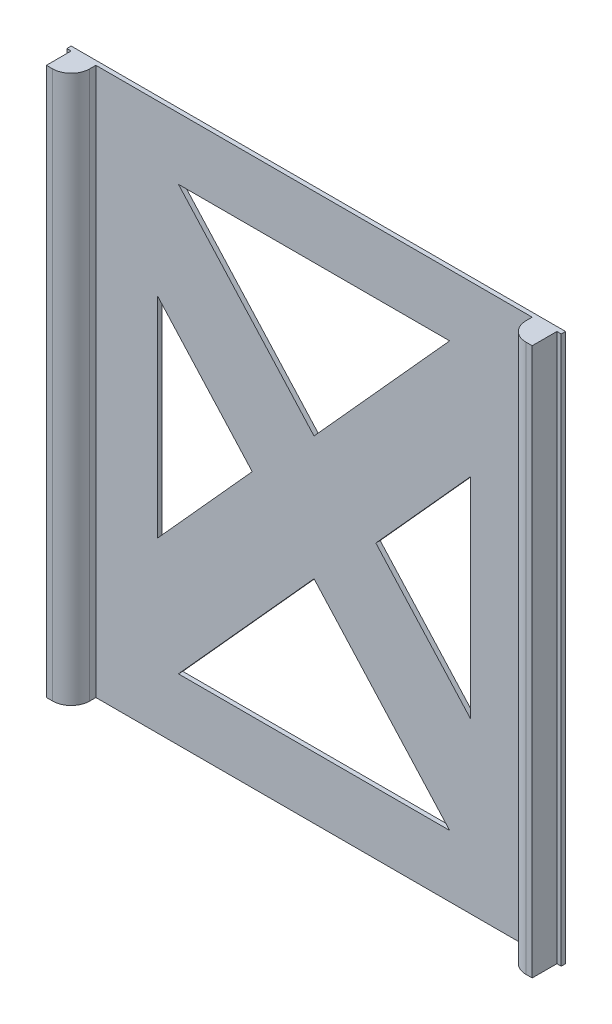
from build123d import *

# Parameters (mm, degrees)
SCHIZZO1_W                   = 800
SCHIZZO1_H                   = 886
ESTRUSIONE_ESTRUSIONE1_DEPTH = 7
SCHIZZO2_W                   = 40
SCHIZZO2_H                   = 886
ESTRUSIONE_ESTRUSIONE2_DEPTH = 40
RACCORDO1_R                  = 30
RACCORDO1_OF_SPECCHIA1_R     = 30
TAGLIO_ESTRUSIONE1_DEPTH     = 599.204814424


with BuildPart() as part:
    # Schizzo1 → Estrusione-Estrusione1 (new body)
    with BuildSketch(Plane.XY):
        Rectangle(SCHIZZO1_W, SCHIZZO1_H)
    extrude(amount=ESTRUSIONE_ESTRUSIONE1_DEPTH)

    # Schizzo2 → Estrusione-Estrusione2 (add)
    with BuildSketch(Plane.XY.offset(7)):
        with Locations((-373, 0)):
            Rectangle(SCHIZZO2_W, SCHIZZO2_H)
    estrusione_estrusione2 = extrude(amount=ESTRUSIONE_ESTRUSIONE2_DEPTH)

    # Raccordo1
    raccordo1_edges = [part.edges().sort_by_distance(p)[0] for p in [
        (-353, 0, 47),
    ]]
    fillet(raccordo1_edges, radius=RACCORDO1_R)

    # Specchia1: Estrusione-Estrusione2 across plane
    add(estrusione_estrusione2.mirror(Plane(origin=(0, 0, 0), x_dir=(0, 0, 1), z_dir=(1, 0, 0))))

    # Raccordo1 of Specchia1
    raccordo1_of_specchia1_edges = [part.edges().sort_by_distance(p)[0] for p in [
        (353, 0, 47),
    ]]
    fillet(raccordo1_of_specchia1_edges, radius=RACCORDO1_OF_SPECCHIA1_R)

    # Schizzo3 → Taglio-Estrusione1 (cut, through all)
    with BuildSketch(Plane.XY.offset(7)):
        Polygon((-100, 0), (-253, 169.4475), (-253, -169.4475), align=None)
        Polygon((253, 169.4475), (253, -169.4475), (100, 0), align=None)
        Polygon((219.413092551, -343), (0, -100), (-219.413092551, -343), align=None)
        Polygon((-219.413092551, 343), (219.413092551, 343), (0, 100), align=None)
    extrude(amount=-TAGLIO_ESTRUSIONE1_DEPTH, mode=Mode.SUBTRACT)


solid = part.part
